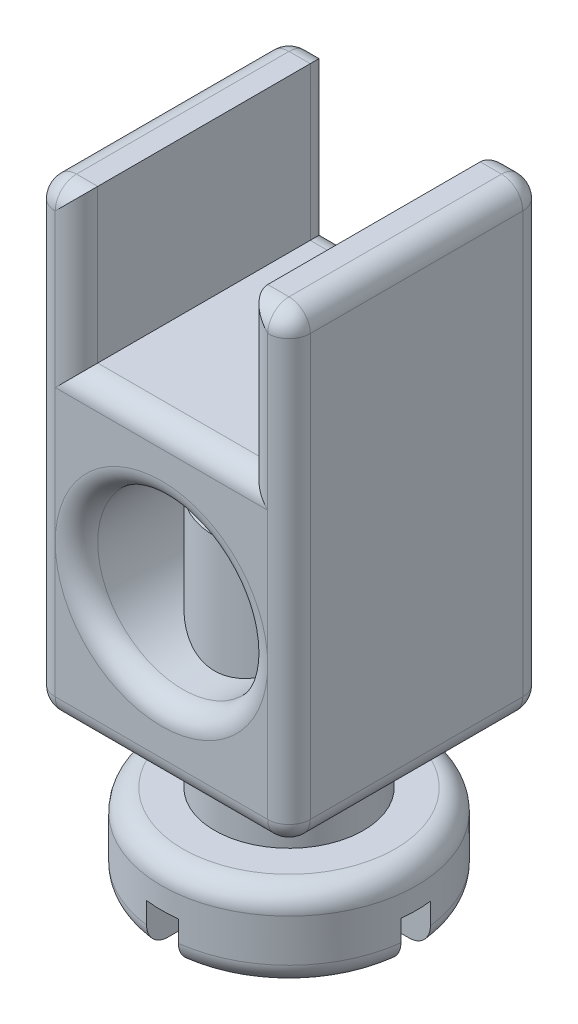
from build123d import *

# Parameters (mm, degrees)
BOSS_EXTRUDE1_DEPTH = 14.5
CUT_EXTRUDE1_DEPTH  = 3.6
CUT_EXTRUDE2_DEPTH  = 3.6
CUT_EXTRUDE3_START  = -2
SKETCH4_R           = 3.0000000000000004
SKETCH4_R_2         = 1.75
CUT_EXTRUDE3_DEPTH  = 1.6
SKETCH5_R           = 2
CUT_EXTRUDE4_DEPTH  = 5
FILLET1_R           = 0.5
FILLET3_R           = 0.5
SKETCH6_W           = 0.7512194361763478
SKETCH6_H           = 6
CUT_EXTRUDE5_DEPTH  = 1
SKETCH7_W           = 7.9403086641005265
SKETCH7_H           = 0.6946760377543701
CUT_EXTRUDE6_DEPTH  = 1
SKETCH8_R           = 1.75
BOSS_EXTRUDE2_DEPTH = 7


with BuildPart() as part:
    # Sketch1 → Boss-Extrude1 (new body)
    with BuildSketch(Plane(origin=(0, 0, 0), x_dir=(1, 0, 0), z_dir=(0, 1, 0))):
        Polygon((-3.0000000000000004, 3), (2.9999999999999996, 3), (3.0000000000000004, -3), (-2.9999999999999996, -3), align=None)
    extrude(amount=BOSS_EXTRUDE1_DEPTH)

    # Sketch2 → Cut-Extrude1 (cut)
    with BuildSketch(Plane(origin=(0, 14.5, 0), x_dir=(1, 0, 0), z_dir=(0, 1, 0))):
        Polygon((2, 3), (-2, 3), (-2, -3), (2, -2.9999999999999982), align=None)
    extrude(amount=-CUT_EXTRUDE1_DEPTH, mode=Mode.SUBTRACT)

    # Sketch3 → Cut-Extrude2 (cut)
    with BuildSketch(Plane.XZ):
        with BuildLine():
            ThreePointArc((-4.6684e-13, -3), (-2.121320343559808, -2.1213203435594776), (-3, 3.7e-16))
            Line((-2.9999999999999996, -2.22e-15), (-2.9999999999999996, -3))
            Line((-2.9999999999999996, -3), (-4.6674e-13, -3))
        make_face()
        with BuildLine():
            Line((2.9999999999999996, -3), (2.9999999999999996, 0))
            ThreePointArc((3, -7.3e-16), (2.121320343559478, -2.121320343559807), (-4.6684e-13, -3))
            Line((-4.6674e-13, -3), (2.9999999999999996, -3))
        make_face()
        with BuildLine():
            Line((2.9999999999999996, 3), (-4.6763e-13, 3))
            ThreePointArc((-4.6678e-13, 3), (2.1213203435594776, 2.1213203435598076), (3, 0))
            Line((2.9999999999999996, 0), (2.9999999999999996, 3))
        make_face()
        with BuildLine():
            Line((-4.6763e-13, 3), (-2.9999999999999996, 3))
            Line((-2.9999999999999996, 3), (-2.9999999999999996, -2.22e-15))
            ThreePointArc((-3, 3.7e-16), (-2.121320343559808, 2.1213203435594767), (-4.6744e-13, 3))
        make_face()
    extrude(amount=-CUT_EXTRUDE2_DEPTH, mode=Mode.SUBTRACT)

    # Sketch4 → Cut-Extrude3 (cut)
    with BuildSketch(Plane.XZ.offset(CUT_EXTRUDE3_START)):
        with Locations(Location((0, 0, 0), (0, 0, 270))):
            Circle(SKETCH4_R)
        with Locations(Location((0, 0, 0), (0, 0, 270))):
            Circle(SKETCH4_R_2, mode=Mode.SUBTRACT)
    extrude(amount=-CUT_EXTRUDE3_DEPTH, mode=Mode.SUBTRACT)

    # Sketch5 → Cut-Extrude4 (cut)
    with BuildSketch(Plane.XY.offset(3)):
        with Locations((0, 7.249999999999999)):
            Circle(SKETCH5_R)
    extrude(amount=-CUT_EXTRUDE4_DEPTH, mode=Mode.SUBTRACT)

    # Fillet1
    fillet1_edges = [part.edges().sort_by_distance(p)[0] for p in [
        (-3, 0, 5.9e-16),
        (-3.0000000000000004, 2, 3.82e-15),
    ]]
    fillet(fillet1_edges, radius=FILLET1_R)

    # Fillet3
    fillet3_edges = [part.edges().sort_by_distance(p)[0] for p in [
        (-3, 14.5, 0),
        (-2.5, 14.5, -3),
        (2.5, 14.5, 3),
        (-2.4999999999999996, 14.5, 3),
        (-2, 12.7, 3),
        (0, 10.9, -3),
        (-2, 12.7, -3),
        (2, 12.7, -3),
        (0, 10.9, 2.999999999999999),
        (2, 12.7, 2.9999999999999982),
        (0, 3.6, 3),
        (2.9999999999999996, 3.6, 0),
        (3, 14.5, 0),
        (0, 3.6, -3),
        (-2.9999999999999996, 3.6, 0),
        (3.0000000000000004, 9.05, 3),
        (-2.9999999999999996, 9.05, 3),
        (-3.0000000000000004, 9.05, -3),
        (2.9999999999999996, 9.05, -3),
        (2.4999999999999996, 14.5, -3),
        (-2, 7.249999999999999, 3),
    ]]
    fillet(fillet3_edges, radius=FILLET3_R - 0.0001)  # a hair under: the kernel refuses the full size

    # Sketch6 → Cut-Extrude5 (cut)
    with BuildSketch(Plane.XZ):
        Rectangle(SKETCH6_W, SKETCH6_H)
    extrude(amount=-CUT_EXTRUDE5_DEPTH, mode=Mode.SUBTRACT)

    # Sketch7 → Cut-Extrude6 (cut)
    with BuildSketch(Plane.XZ):
        Rectangle(SKETCH7_W, SKETCH7_H)
    extrude(amount=-CUT_EXTRUDE6_DEPTH, mode=Mode.SUBTRACT)

    # Sketch8 → Boss-Extrude2 (add)
    with BuildSketch(Plane.XZ.offset(-1)):
        with Locations(Location((0, 0, 0), (0, 0, 270))):
            Circle(SKETCH8_R)
    extrude(amount=-BOSS_EXTRUDE2_DEPTH)


solid = part.part
